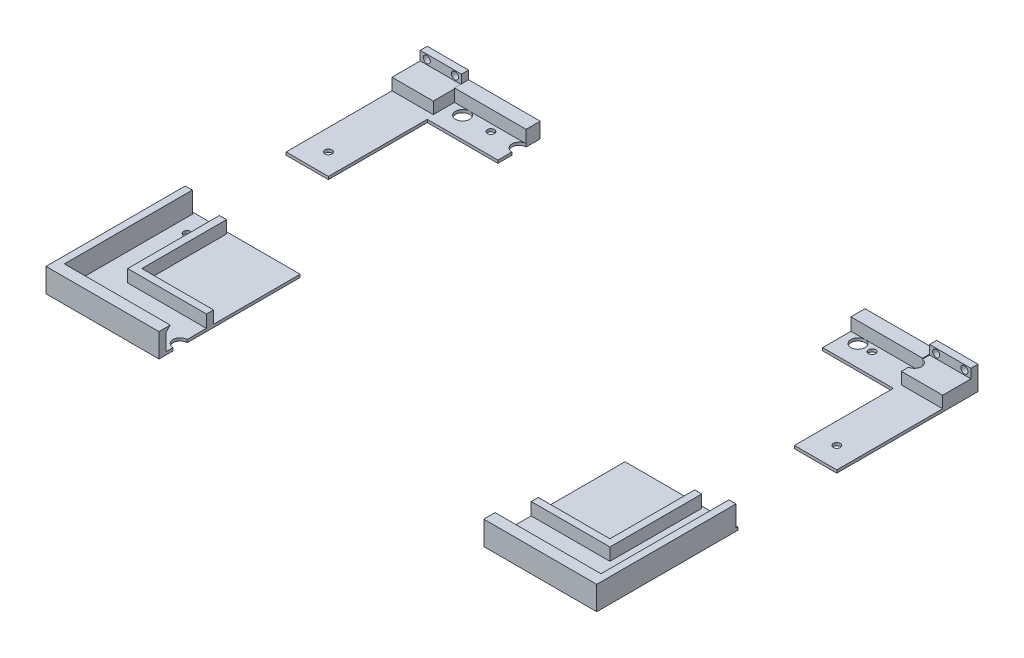
from build123d import *

# Parameters (mm, degrees)
SKETCH1_W                              = 390
SKETCH1_H                              = 270
BOSS_EXTRUDE1_DEPTH                    = 16.825
SKETCH2_W                              = 331.5
SKETCH2_H                              = 231.4
CUT_EXTRUDE1_DEPTH                     = 14.825
SKETCH3_W                              = 170.75
SKETCH3_H                              = 28.6
CUT_EXTRUDE2_DEPTH                     = 14.825
SKETCH4_W                              = 331.5
SKETCH4_H                              = 10
BOSS_EXTRUDE2_DEPTH                    = 8.89
CBORE_FOR_M5_HEX_HEAD_BOLT1_AT_2_COUNT = 2
CBORE_FOR_M5_HEX_HEAD_BOLT1_AT_2_PITCH = 45
CBORE_FOR_M5_HEX_HEAD_BOLT1_AT_3_COUNT = 2
CBORE_FOR_M5_HEX_HEAD_BOLT1_AT_3_PITCH = 70
SKETCH18_W                             = 230
SKETCH18_H                             = 270
SKETCH18_W_2                           = 390
SKETCH18_H_2                           = 70
SKETCH18_W_3                           = 330
CUT_EXTRUDE5_DEPTH                     = 238.766861915
SKETCH23_W                             = 29.25
SKETCH23_H                             = 6.5
CUT_EXTRUDE6_DEPTH                     = 20
SKETCH25_W                             = 2.5
SKETCH25_H                             = 5
F_1_0MM_DOWEL_HOLE1_AT_2_COUNT         = 2
F_1_0MM_DOWEL_HOLE1_AT_2_PITCH         = 20
CUT_EXTRUDE7_DEPTH                     = 6
MIRROR5_COPY_1_SKETCH_W                = 2.5
MIRROR5_COPY_1_SKETCH_H                = 5
SKETCH27_R                             = 5
CUT_EXTRUDE8_DEPTH                     = 238.766861915
SKETCH28_W                             = 75
SKETCH28_H                             = 3
BOSS_EXTRUDE3_DEPTH                    = 3
CHAMFER1_SIZE                          = 3
CHAMFER2_SIZE                          = 3


with BuildPart() as part:
    # Sketch1 → Boss-Extrude1 (new body)
    with BuildSketch(Plane(origin=(0, 0, 0), x_dir=(1, 0, 0), z_dir=(0, 1, 0))):
        Rectangle(SKETCH1_W, SKETCH1_H)
    extrude(amount=BOSS_EXTRUDE1_DEPTH)

    # Sketch2 → Cut-Extrude1 (cut)
    with BuildSketch(Plane(origin=(0, 16.825, 0), x_dir=(1, 0, 0), z_dir=(0, 1, 0))):
        with Locations((0, 19.3)):
            Rectangle(SKETCH2_W, SKETCH2_H)
    extrude(amount=-CUT_EXTRUDE1_DEPTH, mode=Mode.SUBTRACT)

    # Sketch3 → Cut-Extrude2 (cut)
    with BuildSketch(Plane(origin=(0, 16.825, 0), x_dir=(1, 0, 0), z_dir=(0, 1, 0))):
        with Locations((85.375, -115.7)):
            Rectangle(SKETCH3_W, SKETCH3_H)
        Polygon((190, -36.4), (170.75, -36.4), (170.75, -101.4), (170.75, -130), (190, -130), align=None)
        Polygon((165.75, -36.4), (170.75, -36.4), (190, -36.4), (195, -36.4), (195, 110), (165.75, 110), align=None)
    cut_extrude2 = extrude(amount=-CUT_EXTRUDE2_DEPTH, mode=Mode.SUBTRACT)

    # Mirror1: Cut-Extrude2 across plane
    add(cut_extrude2.mirror(Plane(origin=(0, 0, 0), x_dir=(0, 0, 1), z_dir=(1, 0, 0))), mode=Mode.SUBTRACT)

    # Sketch4 → Boss-Extrude2 (add)
    with BuildSketch(Plane(origin=(0, 2, 0), x_dir=(1, 0, 0), z_dir=(0, 1, 0))):
        with Locations((0, 130)):
            Rectangle(SKETCH4_W, SKETCH4_H)
    extrude(amount=BOSS_EXTRUDE2_DEPTH)

    # Sketch22 → CBORE for M5 Hex Head Bolt1 (revolve, cut)
    with BuildSketch(Plane(origin=(180, 0, -120), x_dir=(0, 0, -1), z_dir=(1, 0, 0))):
        Polygon((0, 0), (0, 6.351936393), (2.25, 5), (2.25, 4.2), (2.5, 4.2), (2.5, 0), align=None)
    cbore_for_m5_hex_head_bolt1 = revolve(axis=Axis((180, -6.35, -120), (0, 1, 0)), mode=Mode.SUBTRACT)

    # CBORE for M5 Hex Head Bolt1 at 2: CBORE for M5 Hex Head Bolt1 ×2
    with Locations(*[(-i * CBORE_FOR_M5_HEX_HEAD_BOLT1_AT_2_PITCH, 0, 0) for i in range(1, CBORE_FOR_M5_HEX_HEAD_BOLT1_AT_2_COUNT)]):
        add(cbore_for_m5_hex_head_bolt1, mode=Mode.SUBTRACT)

    # CBORE for M5 Hex Head Bolt1 at 3: CBORE for M5 Hex Head Bolt1 ×2
    with Locations(*[(0, 0, i * CBORE_FOR_M5_HEX_HEAD_BOLT1_AT_3_PITCH) for i in range(1, CBORE_FOR_M5_HEX_HEAD_BOLT1_AT_3_COUNT)]):
        add(cbore_for_m5_hex_head_bolt1, mode=Mode.SUBTRACT)

    # Mirror3: CBORE for M5 Hex Head Bolt1 across plane
    add(cbore_for_m5_hex_head_bolt1.mirror(Plane(origin=(0, 0, 0), x_dir=(0, 0, 1), z_dir=(1, 0, 0))), mode=Mode.SUBTRACT)

    # Mirror3 copy 1 sketch → Mirror3 copy 1 (revolve, cut)
    with BuildSketch(Plane(origin=(-135, 0, -120), x_dir=(0, 0, -1), z_dir=(-1, 0, 0))):
        Polygon((0, 0), (0, -6.351936393), (2.25, -5), (2.25, -4.2), (2.5, -4.2), (2.5, 0), align=None)
    revolve(axis=Axis((-135, -6.35, -120), (0, -1, 0)), mode=Mode.SUBTRACT)

    # Mirror3 copy 2 sketch → Mirror3 copy 2 (revolve, cut)
    with BuildSketch(Plane(origin=(-180, 0, -50), x_dir=(0, 0, -1), z_dir=(-1, 0, 0))):
        Polygon((0, 0), (0, -6.351936393), (2.25, -5), (2.25, -4.2), (2.5, -4.2), (2.5, 0), align=None)
    revolve(axis=Axis((-180, -6.35, -50), (0, -1, 0)), mode=Mode.SUBTRACT)

    # Mirror3 at the second plane: CBORE for M5 Hex Head Bolt1 across plane
    add(cbore_for_m5_hex_head_bolt1.mirror(Plane.XY), mode=Mode.SUBTRACT)

    # Mirror3 at the second plane copy 1 sketc → Mirror3 at the second plane copy 1 (revolve, cut)
    with BuildSketch(Plane(origin=(135, 0, 120), x_dir=(0, 0, 1), z_dir=(1, 0, 0))):
        Polygon((0, 0), (0, -6.351936393), (2.25, -5), (2.25, -4.2), (2.5, -4.2), (2.5, 0), align=None)
    revolve(axis=Axis((135, -6.35, 120), (0, -1, 0)), mode=Mode.SUBTRACT)

    # Mirror3 at the second plane copy 2 sketc → Mirror3 at the second plane copy 2 (revolve, cut)
    with BuildSketch(Plane(origin=(180, 0, 50), x_dir=(0, 0, 1), z_dir=(1, 0, 0))):
        Polygon((0, 0), (0, -6.351936393), (2.25, -5), (2.25, -4.2), (2.5, -4.2), (2.5, 0), align=None)
    revolve(axis=Axis((180, -6.35, 50), (0, -1, 0)), mode=Mode.SUBTRACT)

    # Mirror3 at the second plane copy 3 sketc → Mirror3 at the second plane copy 3 (revolve, cut)
    with BuildSketch(Plane(origin=(-180, 0, 120), x_dir=(0, 0, 1), z_dir=(-1, 0, 0))):
        Polygon((0, 0), (0, 6.351936393), (2.25, 5), (2.25, 4.2), (2.5, 4.2), (2.5, 0), align=None)
    revolve(axis=Axis((-180, -6.35, 120), (0, 1, 0)), mode=Mode.SUBTRACT)

    # Mirror3 at the second plane copy 4 sketc → Mirror3 at the second plane copy 4 (revolve, cut)
    with BuildSketch(Plane(origin=(-135, 0, 120), x_dir=(0, 0, 1), z_dir=(-1, 0, 0))):
        Polygon((0, 0), (0, 6.351936393), (2.25, 5), (2.25, 4.2), (2.5, 4.2), (2.5, 0), align=None)
    revolve(axis=Axis((-135, -6.35, 120), (0, 1, 0)), mode=Mode.SUBTRACT)

    # Mirror3 at the second plane copy 5 sketc → Mirror3 at the second plane copy 5 (revolve, cut)
    with BuildSketch(Plane(origin=(-180, 0, 50), x_dir=(0, 0, 1), z_dir=(-1, 0, 0))):
        Polygon((0, 0), (0, 6.351936393), (2.25, 5), (2.25, 4.2), (2.5, 4.2), (2.5, 0), align=None)
    revolve(axis=Axis((-180, -6.35, 50), (0, 1, 0)), mode=Mode.SUBTRACT)

    # Sketch18 → Cut-Extrude5 (cut, through all)
    with BuildSketch(Plane.XZ):
        Rectangle(SKETCH18_W, SKETCH18_H)
        Rectangle(SKETCH18_W_2, SKETCH18_H_2)
        with Locations((0, -70)):
            Rectangle(SKETCH18_W_3, SKETCH18_H_2)
    extrude(amount=-CUT_EXTRUDE5_DEPTH, mode=Mode.SUBTRACT)


with BuildPart() as cut_extrude5_piece_1:
    # of the separate pieces the step leaves, piece 1, a body of its own (cut_extrude5_pieces)
    add(part.part.solids().sort_by_distance((-195, 0, 135))[0])


with BuildPart() as cut_extrude5_piece_2:
    # of the separate pieces the step leaves, piece 2, a body of its own (cut_extrude5_pieces)
    add(part.part.solids().sort_by_distance((115, 0, 135))[0])


with BuildPart() as cut_extrude5_piece_3:
    # of the separate pieces the step leaves, piece 3, a body of its own (cut_extrude5_pieces)
    add(part.part.solids().sort_by_distance((165, 0, -35))[0])


with BuildPart() as cut_extrude5_piece_4:
    # of the separate pieces the step leaves, piece 4, a body of its own (cut_extrude5_pieces)
    add(part.part.solids().sort_by_distance((-195, 0, -135))[0])

    # Sketch23 → Cut-Extrude6 (cut)
    with BuildSketch(Plane.XY.offset(-110)):
        with Locations((-180.375, 13.575)):
            Rectangle(SKETCH23_W, SKETCH23_H)
    cut_extrude6 = extrude(amount=-CUT_EXTRUDE6_DEPTH, mode=Mode.SUBTRACT)

    # Sketch25 → Ø1.0mm Dowel Hole1 (revolve, cut)
    with BuildSketch(Plane(origin=(-190.375, 13.625, -130), x_dir=(0, -1, 0), z_dir=(1, 0, 0))):
        with Locations((1.25, 2.5)):
            Rectangle(SKETCH25_W, SKETCH25_H)
    f_1_0mm_dowel_hole1 = revolve(axis=Axis((-190.375, 13.625, -123.65), (0, 0, -1)), mode=Mode.SUBTRACT)

    # Ø1.0mm Dowel Hole1 at 2: Ø1.0mm Dowel Hole1 ×2
    with Locations(*[(i * F_1_0MM_DOWEL_HOLE1_AT_2_PITCH, 0, 0) for i in range(1, F_1_0MM_DOWEL_HOLE1_AT_2_COUNT)]):
        add(f_1_0mm_dowel_hole1, mode=Mode.SUBTRACT)


with BuildPart() as cut_extrude7_tool:
    # Sketch26 → Cut-Extrude7 (new body)
    with BuildSketch(Plane(origin=(0, 16.825, 0), x_dir=(1, 0, 0), z_dir=(0, 1, 0))):
        Polygon((115, -96.4), (115, -101.4), (170.75, -101.4), (170.75, -36.4), (165.75, -36.4), (165.75, -96.4), align=None)
        Polygon((-170.75, -36.4), (-170.75, -101.4), (-115, -101.4), (-115, -96.4), (-165.75, -96.4), (-165.75, -36.4), align=None)
    extrude(amount=-CUT_EXTRUDE7_DEPTH)


with BuildPart() as cut_extrude5_piece_1_1:
    add(cut_extrude5_piece_1.part)

    # Cut-Extrude7: cut by cut_extrude7_tool
    add(cut_extrude7_tool.part, mode=Mode.SUBTRACT)


with BuildPart() as cut_extrude5_piece_2_1:
    add(cut_extrude5_piece_2.part)

    # Cut-Extrude7: cut by cut_extrude7_tool
    add(cut_extrude7_tool.part, mode=Mode.SUBTRACT)


with BuildPart() as cut_extrude5_piece_3_1:
    add(cut_extrude5_piece_3.part)

    # Mirror5: Cut-Extrude6, Ø1.0mm Dowel Hole1 across plane
    add(cut_extrude6.mirror(Plane(origin=(0, 0, 0), x_dir=(0, 0, 1), z_dir=(1, 0, 0))), mode=Mode.SUBTRACT)
    add(f_1_0mm_dowel_hole1.mirror(Plane(origin=(0, 0, 0), x_dir=(0, 0, 1), z_dir=(1, 0, 0))), mode=Mode.SUBTRACT)

    # Mirror5 copy 1 sketch → Mirror5 copy 1 (revolve, cut)
    with BuildSketch(Plane(origin=(170.375, 13.625, -130), x_dir=(0, -1, 0), z_dir=(-1, 0, 0))):
        with Locations((1.25, -2.5)):
            Rectangle(MIRROR5_COPY_1_SKETCH_W, MIRROR5_COPY_1_SKETCH_H)
    revolve(axis=Axis((170.375, 13.625, -123.65), (0, 0, 1)), mode=Mode.SUBTRACT)


with BuildPart() as cut_extrude8_tool:
    # Sketch27 → Cut-Extrude8 (new, through all)
    with BuildSketch(Plane(origin=(0, 0, 0), x_dir=(1, 0, 0), z_dir=(0, 1, 0))):
        with Locations(Location((165, 120, 0), (0, 0, 90))):
            Circle(SKETCH27_R)
        with Locations(Location((125, 120, 0), (0, 0, 90))):
            Circle(SKETCH27_R)
        with Locations(Location((-155, 120, 0), (0, 0, 90))):
            Circle(SKETCH27_R)
        with Locations((-115, 120)):
            Circle(SKETCH27_R)
    cut_extrude8 = extrude(amount=CUT_EXTRUDE8_DEPTH)


with BuildPart() as cut_extrude5_piece_3_2:
    add(cut_extrude5_piece_3_1.part)

    # Cut-Extrude8: cut by cut_extrude8_tool
    add(cut_extrude8_tool.part, mode=Mode.SUBTRACT)


with BuildPart() as cut_extrude5_piece_4_1:
    add(cut_extrude5_piece_4.part)

    # Cut-Extrude8: cut by cut_extrude8_tool
    add(cut_extrude8_tool.part, mode=Mode.SUBTRACT)


with BuildPart() as mirror6_tool:
    # Mirror6: Cut-Extrude8 across plane
    add(cut_extrude8.mirror(Plane.XY))


with BuildPart() as cut_extrude5_piece_1_2:
    add(cut_extrude5_piece_1_1.part)

    # Mirror6: cut by mirror6_tool
    add(mirror6_tool.part, mode=Mode.SUBTRACT)



with BuildPart() as cut_extrude5_piece_2_2:
    add(cut_extrude5_piece_2_1.part)

    # Mirror6: cut by mirror6_tool
    add(mirror6_tool.part, mode=Mode.SUBTRACT)


with BuildPart() as cut_extrude5_piece_1_3:
    add(cut_extrude5_piece_1_2.part)

    add(cut_extrude5_piece_2_2.part)  # Boss-Extrude3 merges Cut-Extrude5 piece 2
    # Sketch28 → Boss-Extrude3 (add)
    with BuildSketch(Plane(origin=(0, 0, 130), x_dir=(-1, 0, 0), z_dir=(0, 0, -1))):
        with Locations((152.5, 15.325)):
            Rectangle(SKETCH28_W, SKETCH28_H)
        with Locations((-152.5, 15.325)):
            Rectangle(SKETCH28_W, SKETCH28_H)
    extrude(amount=BOSS_EXTRUDE3_DEPTH)

    # Chamfer1
    chamfer1_edges = [cut_extrude5_piece_1_3.edges().sort_by_distance(p)[0] for p in [
        (152.5, 13.825, 127),
    ]]
    chamfer(chamfer1_edges, length=CHAMFER1_SIZE - 0.0001)  # a hair under: the kernel refuses the full size

    # Chamfer2
    chamfer2_edges = [cut_extrude5_piece_1_3.edges().sort_by_distance(p)[0] for p in [
        (-152.5, 13.825, 127),
    ]]
    chamfer(chamfer2_edges, length=CHAMFER2_SIZE - 0.0001)  # a hair under: the kernel refuses the full size


solid = Compound([cut_extrude5_piece_3_2.part, cut_extrude5_piece_4_1.part, cut_extrude5_piece_1_3.part])
